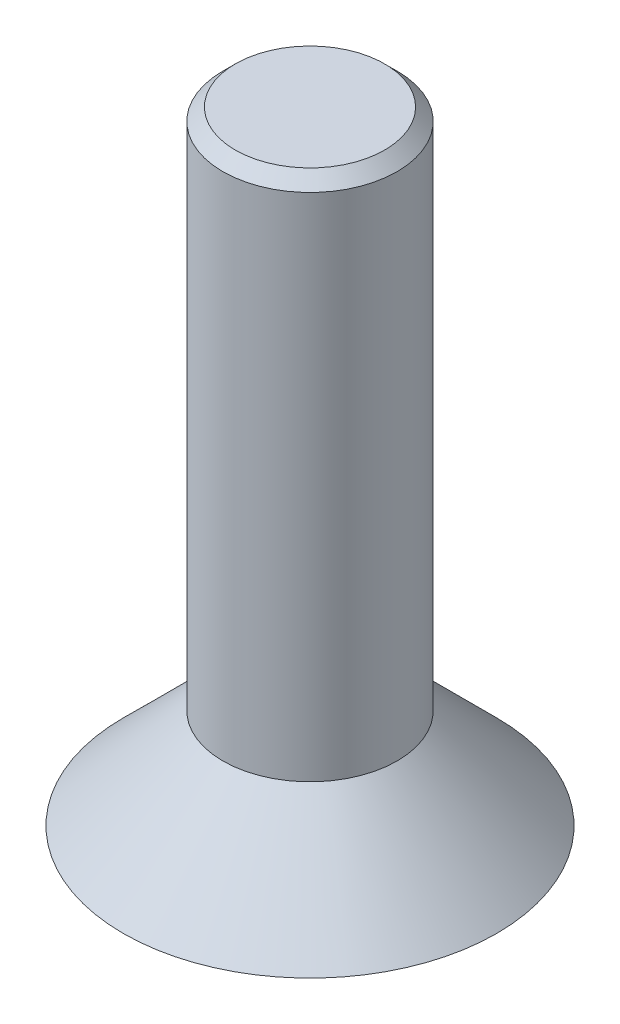
from build123d import *

# Parameters (mm, degrees)
SKETCH_1_R      = 3
EXTRUDE_1_DEPTH = 1.6
CHAMFER_1_SIZE  = 1.6
SKETCH_2_R      = 1.4
EXTRUDE_2_DEPTH = 8.4
CHAMFER_2_SIZE  = 0.2


with BuildPart() as part:
    # 草图1 → 凸台-拉伸1 (new body)
    with BuildSketch(Plane(origin=(0, 0, 0), x_dir=(1, 0, 0), z_dir=(0, 1, 0))):
        with Locations(Location((0, 0, 0), (0, 0, 270))):
            Circle(SKETCH_1_R)
        Polygon((0, -1.154700538), (1, -0.577350269), (1, 0.577350269), (0, 1.154700538), (-1, 0.577350269), (-1, -0.577350269), align=None, mode=Mode.SUBTRACT)
    extrude(amount=EXTRUDE_1_DEPTH)

    # 倒角1
    # the kernel refuses this chamfer: 1.6 mm, written as the material it takes off along each edge
    with BuildSketch(Plane(origin=(0, 1.6, 0), x_dir=(0, 0, 1), z_dir=(-1, 0, 0))) as chamfer_1_piece_1:
        Polygon((3, -CHAMFER_1_SIZE), (3 - CHAMFER_1_SIZE, 0), (3, 0), align=None)
    revolve(axis=Axis((0, 1.6, 0), (0, 1, 0)), mode=Mode.SUBTRACT)

    # 草图2 → 凸台-拉伸2 (add)
    with BuildSketch(Plane(origin=(0, 1.6, 0), x_dir=(1, 0, 0), z_dir=(0, 1, 0))):
        with Locations(Location((0, 0, 0), (0, 0, 270))):
            Circle(SKETCH_2_R)
    extrude(amount=EXTRUDE_2_DEPTH)

    # 倒角2
    chamfer_2_edges = [part.edges().sort_by_distance(p)[0] for p in [
        (0, 10, -1.4),
    ]]
    chamfer(chamfer_2_edges, length=CHAMFER_2_SIZE)


solid = part.part
